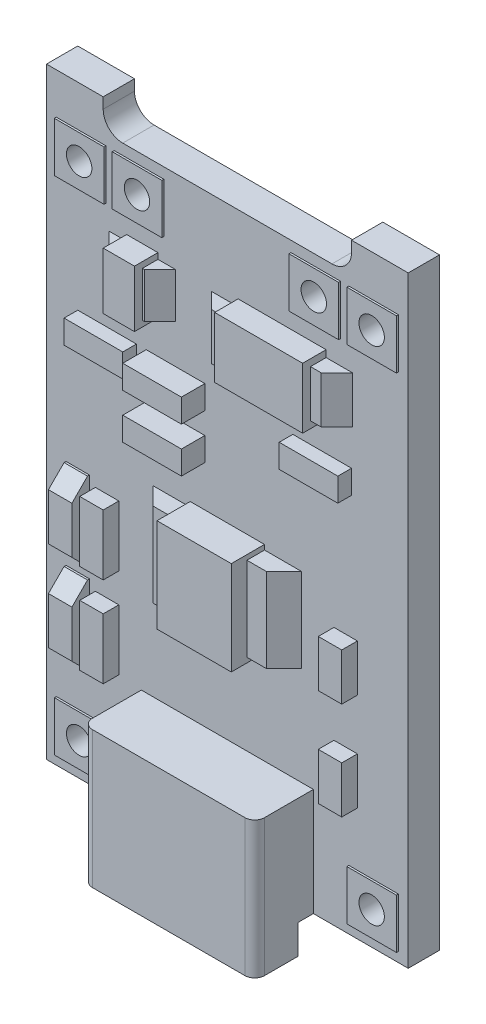
from build123d import *

# Parameters (mm, degrees)
SKICA1_W                      = 8.8
SKICA1_H                      = 5.5
SKICA1_W_2                    = 1.9
SKICA1_H_2                    = 4.3
SKICA1_W_3                    = 3.8
SKICA1_H_3                    = 0.25
P_IDAT_VYSUNUT_M1_DEPTH       = 1.6
ZAOBLIT1_R                    = 1
SKICA1_3_W                    = 8.8
SKICA1_3_H                    = 5.5
SKICA1_3_H_2                  = 1.5
P_IDAT_VYSUNUT_M2_DEPTH       = 3
SKICA1_4_W                    = 3.8
SKICA1_4_H                    = 4.8
P_IDAT_VYSUNUT_M3_DEPTH       = 1.7
SKICA1_5_W                    = 7.6
SKICA1_5_H                    = 4.3
P_IDAT_VYSUNUT_M4_DEPTH       = 0.9
ZKOSEN_1_SIZE                 = 0.9
SKICA2_W                      = 4.5
SKICA2_H                      = 3.1
SKICA2_W_2                    = 1.6
SKICA2_H_2                    = 2.9
P_IDAT_VYSUNUT_M5_DEPTH       = 1.2
SKICA2_3_W                    = 7.2
SKICA2_3_H                    = 2.4
SKICA2_3_W_2                  = 3.4
SKICA2_3_H_2                  = 2.3
P_IDAT_VYSUNUT_M6_DEPTH       = 0.8
ZKOSEN_2_SIZE                 = 0.8
SKICA3_W                      = 8
SKICA3_H                      = 2.2
ODEBRAT_VYSUNUT_M1_DEPTH      = 3.6
ZAOBLIT2_R                    = 1
ZKOSEN_3_SIZE                 = 0.8
ZAOBLIT3_R                    = 0.5
SKICA4_W                      = 1.2
SKICA4_H                      = 2.4
P_IDAT_VYSUNUT_M7_DEPTH       = 0.8
SKICA5_W                      = 3
SKICA5_H                      = 1.2
P_IDAT_VYSUNUT_M8_DEPTH       = 0.7
SKICA5_3_W                    = 3
SKICA5_3_H                    = 1.2
P_IDAT_VYSUNUT_M9_DEPTH       = 1.2
SKICA6_W                      = 1.2
SKICA6_H                      = 3.1
P_IDAT_VYSUNUT_M10_DEPTH      = 0.8
SKICA6_3_W                    = 1.2
SKICA6_3_H                    = 4
P_IDAT_VYSUNUT_M11_DEPTH      = 0.9
ZKOSEN_4_SIZE                 = 0.8
P_IDAT_VYSUNUT_M12_DEPTH      = 0.1
P_IDAT_VYSUNUT_M12_DEPTH_BACK = 1.2
SKICA7_W                      = 2.54
SKICA7_H                      = 2.54
SKICA7_R                      = 0.65
SKICA7_2_R                    = 0.65
ODEBRAT_VYSUNUT_M2_DEPTH      = 20.498012719


with BuildPart() as part:
    # Skica1 → Přidat vysunutím1 (new body)
    # profile 1 of 7: a face of its own
    with BuildSketch(Plane.XY):
        Polygon((-9.25, 15.4), (-9.25, -15.4), (-4.4, -15.4), (-4.4, -9.9), (4.4, -9.9), (4.4, -15.4), (9.25, -15.4), (9.25, 15.4), (6.35, 15.4), (6.35, 13.85), (-6.35, 13.85), (-6.35, 15.4), align=None)
        Polygon((-1.9, -0.55), (-1.9, -0.3), (1.9, -0.3), (1.9, -0.55), (3.8, -0.55), (3.8, -4.85), (1.9, -4.85), (1.9, -5.1), (-1.9, -5.1), (-1.9, -4.85), (-3.8, -4.85), (-3.8, -0.55), align=None, mode=Mode.SUBTRACT)
    # profile 2 of 7: a face of its own
    with BuildSketch(Plane.XY):
        with Locations((0, -12.65)):
            Rectangle(SKICA1_W, SKICA1_H)
    # profile 3 of 7: a face of its own
    with BuildSketch(Plane.XY):
        with Locations((2.85, -2.7)):
            Rectangle(SKICA1_W_2, SKICA1_H_2)
    # profile 4 of 7: a face of its own
    with BuildSketch(Plane.XY):
        with Locations((-2.85, -2.7)):
            Rectangle(SKICA1_W_2, SKICA1_H_2)
    # profile 5 of 7: a face of its own
    with BuildSketch(Plane.XY):
        with Locations((0, -2.7)):
            Rectangle(SKICA1_W_3, SKICA1_H_2)
    # profile 6 of 7: a face of its own
    with BuildSketch(Plane.XY):
        with Locations((0, -4.975)):
            Rectangle(SKICA1_W_3, SKICA1_H_3)
    # profile 7 of 7: a face of its own
    with BuildSketch(Plane.XY):
        with Locations((0, -0.425)):
            Rectangle(SKICA1_W_3, SKICA1_H_3)
    extrude(amount=-P_IDAT_VYSUNUT_M1_DEPTH)

    # Zaoblit1
    zaoblit1_edges = [part.edges().sort_by_distance(p)[0] for p in [
        (-6.35, 13.85, -0.8),
        (6.35, 13.85, -0.8),
    ]]
    fillet(zaoblit1_edges, radius=ZAOBLIT1_R)

    # Skica1<3> → Přidat vysunutím2 (add)
    with BuildSketch(Plane.XY):
        with Locations((0, -12.65)):
            Rectangle(SKICA1_3_W, SKICA1_3_H)
        with Locations((0, -16.15)):
            Rectangle(SKICA1_3_W, SKICA1_3_H_2)
    extrude(amount=P_IDAT_VYSUNUT_M2_DEPTH)

    # Skica1<4> → Přidat vysunutím3 (add)
    with BuildSketch(Plane.XY):
        with Locations((0, -2.7)):
            Rectangle(SKICA1_4_W, SKICA1_4_H)
    extrude(amount=P_IDAT_VYSUNUT_M3_DEPTH)

    # Skica1<5> → Přidat vysunutím4 (add)
    with BuildSketch(Plane.XY):
        with Locations((0, -2.7)):
            Rectangle(SKICA1_5_W, SKICA1_5_H)
    extrude(amount=P_IDAT_VYSUNUT_M4_DEPTH)

    # Zkosení1
    zkosen_1_edges = [part.edges().sort_by_distance(p)[0] for p in [
        (-3.8, -2.7, 0.9),
        (3.8, -2.7, 0.9),
    ]]
    chamfer(zkosen_1_edges, length=ZKOSEN_1_SIZE - 0.0001)  # a hair under: the kernel refuses the full size

    # Skica2 → Přidat vysunutím5 (add)
    with BuildSketch(Plane.XY):
        with Locations((2.8, 8.35)):
            Rectangle(SKICA2_W, SKICA2_H)
        with Locations((-4.35, 8.45)):
            Rectangle(SKICA2_W_2, SKICA2_H_2)
    extrude(amount=P_IDAT_VYSUNUT_M5_DEPTH)

    # Skica2<3> → Přidat vysunutím6 (add)
    with BuildSketch(Plane.XY):
        with Locations((2.8, 8.35)):
            Rectangle(SKICA2_3_W, SKICA2_3_H)
        with Locations((-4.35, 8.45)):
            Rectangle(SKICA2_3_W_2, SKICA2_3_H_2)
    extrude(amount=P_IDAT_VYSUNUT_M6_DEPTH)

    # Zkosení2
    zkosen_2_edges = [part.edges().sort_by_distance(p)[0] for p in [
        (6.4, 8.35, 0.8),
        (-0.8, 8.35, 0.8),
        (-2.65, 8.45, 0.8),
        (-6.05, 8.45, 0.8),
    ]]
    chamfer(zkosen_2_edges, length=ZKOSEN_2_SIZE - 0.0001)  # a hair under: the kernel refuses the full size

    # Skica3 → Odebrat vysunutím1 (cut)
    with BuildSketch(Plane.XZ.offset(16.9)):
        with Locations((0, 1.5)):
            Rectangle(SKICA3_W, SKICA3_H)
    extrude(amount=-ODEBRAT_VYSUNUT_M1_DEPTH, mode=Mode.SUBTRACT)

    # Zaoblit2
    zaoblit2_edges = [part.edges().sort_by_distance(p)[0] for p in [
        (4, -15.1, 0.4),
        (-4, -15.1, 0.4),
    ]]
    fillet(zaoblit2_edges, radius=ZAOBLIT2_R)

    # Zkosení3
    zkosen_3_edges = [part.edges().sort_by_distance(p)[0] for p in [
        (4.4, -16.15, 0),
        (-4.4, -16.15, 0),
    ]]
    chamfer(zkosen_3_edges, length=ZKOSEN_3_SIZE)

    # Zaoblit3
    zaoblit3_edges = [part.edges().sort_by_distance(p)[0] for p in [
        (4.4, -13.4, 3),
        (-4.4, -13.4, 3),
    ]]
    fillet(zaoblit3_edges, radius=ZAOBLIT3_R)

    # Skica4 → Přidat vysunutím7 (add)
    with BuildSketch(Plane.XY):
        with Locations((6.05, -3.4)):
            Rectangle(SKICA4_W, SKICA4_H)
        with Locations((6.05, -8.4)):
            Rectangle(SKICA4_W, SKICA4_H)
    extrude(amount=P_IDAT_VYSUNUT_M7_DEPTH)

    # Skica5 → Přidat vysunutím8 (add)
    with BuildSketch(Plane.XY):
        with Locations((-6.15, 4.7)):
            Rectangle(SKICA5_W, SKICA5_H)
        with Locations((4.85, 4.7)):
            Rectangle(SKICA5_W, SKICA5_H)
    extrude(amount=P_IDAT_VYSUNUT_M8_DEPTH)

    # Skica5<3> → Přidat vysunutím9 (add)
    with BuildSketch(Plane.XY):
        with Locations((-2.65, 4.7)):
            Rectangle(SKICA5_3_W, SKICA5_3_H)
        with Locations((-2.65, 2.4)):
            Rectangle(SKICA5_3_W, SKICA5_3_H)
    extrude(amount=P_IDAT_VYSUNUT_M9_DEPTH)

    # Skica6 → Přidat vysunutím10 (add)
    with BuildSketch(Plane.XY):
        with Locations((-6.15, -3.65)):
            Rectangle(SKICA6_W, SKICA6_H)
        with Locations((-6.15, -8.25)):
            Rectangle(SKICA6_W, SKICA6_H)
    extrude(amount=P_IDAT_VYSUNUT_M10_DEPTH)

    # Skica6<3> → Přidat vysunutím11 (add)
    with BuildSketch(Plane.XY):
        with Locations((-7.65, -8.3)):
            Rectangle(SKICA6_3_W, SKICA6_3_H)
        with Locations((-7.65, -3.7)):
            Rectangle(SKICA6_3_W, SKICA6_3_H)
    extrude(amount=P_IDAT_VYSUNUT_M11_DEPTH)

    # Zkosení4
    zkosen_4_edges = [part.edges().sort_by_distance(p)[0] for p in [
        (-7.65, -6.3, 0.9),
        (-7.65, -10.3, 0.9),
        (-7.65, -1.7, 0.9),
        (-7.65, -5.7, 0.9),
    ]]
    chamfer(zkosen_4_edges, length=ZKOSEN_4_SIZE)

    # Skica7 → Přidat vysunutím12 (add, two sides: drawn at the far end of the back side and taken through both)
    # profile 1 of 6: a face of its own
    with BuildSketch(Plane.XY.offset(-P_IDAT_VYSUNUT_M12_DEPTH_BACK)):
        with Locations((-7.48, 12.03)):
            Rectangle(SKICA7_W, SKICA7_H)
        with Locations((-7.48, 12.03)):
            Circle(SKICA7_R, mode=Mode.SUBTRACT)
    # profile 2 of 6: a face of its own
    with BuildSketch(Plane.XY.offset(-P_IDAT_VYSUNUT_M12_DEPTH_BACK)):
        with Locations((-4.52, 12.03)):
            Rectangle(SKICA7_W, SKICA7_H)
        with Locations((-4.52, 12.03)):
            Circle(SKICA7_R, mode=Mode.SUBTRACT)
    # profile 3 of 6: a face of its own
    with BuildSketch(Plane.XY.offset(-P_IDAT_VYSUNUT_M12_DEPTH_BACK)):
        with Locations((-7.48, -13.63)):
            Rectangle(SKICA7_W, SKICA7_H)
        with Locations((-7.48, -13.63)):
            Circle(SKICA7_R, mode=Mode.SUBTRACT)
    # profile 4 of 6: a face of its own
    with BuildSketch(Plane.XY.offset(-P_IDAT_VYSUNUT_M12_DEPTH_BACK)):
        with Locations((7.48, -13.63)):
            Rectangle(SKICA7_W, SKICA7_H)
        with Locations((7.48, -13.63)):
            Circle(SKICA7_R, mode=Mode.SUBTRACT)
    # profile 5 of 6: a face of its own
    with BuildSketch(Plane.XY.offset(-P_IDAT_VYSUNUT_M12_DEPTH_BACK)):
        with Locations((4.52, 12.03)):
            Rectangle(SKICA7_W, SKICA7_H)
        with Locations((4.52, 12.03)):
            Circle(SKICA7_R, mode=Mode.SUBTRACT)
    # profile 6 of 6: a face of its own
    with BuildSketch(Plane.XY.offset(-P_IDAT_VYSUNUT_M12_DEPTH_BACK)):
        with Locations((7.48, 12.03)):
            Rectangle(SKICA7_W, SKICA7_H)
        with Locations((7.48, 12.03)):
            Circle(SKICA7_R, mode=Mode.SUBTRACT)
    extrude(amount=P_IDAT_VYSUNUT_M12_DEPTH + P_IDAT_VYSUNUT_M12_DEPTH_BACK)

    # Skica7<2> → Odebrat vysunutím2 (cut, through all)
    with BuildSketch(Plane.XY):
        with Locations((-7.48, -13.63)):
            Circle(SKICA7_2_R)
        with Locations((7.48, -13.63)):
            Circle(SKICA7_2_R)
        with Locations((-7.48, 12.03)):
            Circle(SKICA7_2_R)
        with Locations((-4.52, 12.03)):
            Circle(SKICA7_2_R)
        with Locations((4.52, 12.03)):
            Circle(SKICA7_2_R)
        with Locations((7.48, 12.03)):
            Circle(SKICA7_2_R)
    extrude(amount=-ODEBRAT_VYSUNUT_M2_DEPTH, mode=Mode.SUBTRACT)


solid = part.part
